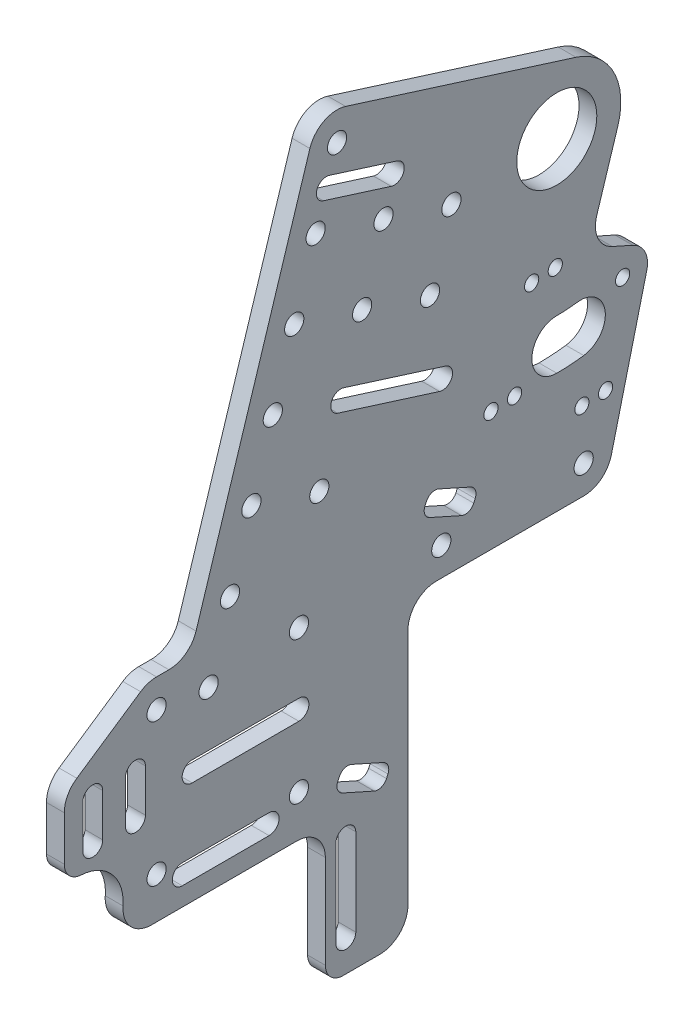
from build123d import *

# Parameters (mm, degrees)
BOSS_EXTRUDE1_DEPTH      = 3.175
BOSS_EXTRUDE1_DEPTH_BACK = 3.175
SKETCH2_R                = 14.2875
SKETCH2_R_2              = 3.429
SKETCH2_R_3              = 2.54


with BuildPart() as part:
    # Sketch2 → Boss-Extrude1 (new, two sides: drawn at the far end of the back side and taken through both)
    with BuildSketch(Plane(origin=(0, 0, 0), x_dir=(0, 0, -1), z_dir=(1, 0, 0)).offset(-BOSS_EXTRUDE1_DEPTH_BACK)):
        with BuildLine():
            Line((38.021448917, 246.234864084), (120.241230069, 220.311066665))
            ThreePointArc((120.241230069, 220.311066665), (133.644163138, 209.06467047), (135.169064986, 191.634962595))
            Line((135.169064986, 191.634962595), (127.622152065, 167.6992128))
            ThreePointArc((127.622152065, 167.6992128), (128.044603019, 160.47960856), (133.162508812, 155.36999111))
            Line((133.162508812, 155.36999111), (140.48887895, 152.092017357))
            ThreePointArc((140.48887895, 152.092017357), (144.852236282, 147.866521475), (145.483799346, 141.825426314))
            Line((145.483799346, 141.825426314), (132.821367632, 91.06703794))
            ThreePointArc((132.821367632, 91.06703794), (129.218084699, 85.519642021), (122.963479706, 83.366234079))
            Line((122.963479706, 83.366234079), (70.42350039, 83.366234079))
            ThreePointArc((70.42350039, 83.366234079), (63.239295493, 80.390438976), (60.26350039, 73.206234079))
            Line((60.26350039, 73.206234079), (60.26350039, -11.7475))
            ThreePointArc((60.26350039, -11.7475), (57.287705287, -18.931704897), (50.10350039, -21.9075))
            Line((50.10350039, -21.9075), (37.1475, -21.9075))
            ThreePointArc((37.1475, -21.9075), (32.657371939, -20.047628061), (30.7975, -15.5575))
            Line((30.7975, -15.5575), (30.7975, 17.78))
            ThreePointArc((30.7975, 17.78), (27.821704897, 24.964204897), (20.6375, 27.94))
            Line((20.6375, 27.94), (-31.256978796, 27.94))
            ThreePointArc((-31.256978796, 27.94), (-38.707276299, 31.19213006), (-41.38801938, 38.866561592))
            ThreePointArc((-41.38801938, 38.866561592), (-45.28789684, 50.537792221), (-56.355984579, 55.915905494))
            ThreePointArc((-56.355984579, 55.915905494), (-60.621662669, 57.889989399), (-62.361270294, 62.25654206))
            Line((-62.361270294, 62.25654206), (-62.361270294, 78.164314079))
            ThreePointArc((-62.361270294, 78.164314079), (-61.17251471, 82.933210558), (-57.884425091, 86.586151856))
            Line((-57.884425091, 86.586151856), (-35.119675091, 101.948071856))
            ThreePointArc((-35.119675091, 101.948071856), (-32.408029017, 103.24198088), (-29.436520294, 103.686234079))
            Line((-29.436520294, 103.686234079), (-25.026637608, 103.686234079))
            ThreePointArc((-25.026637608, 103.686234079), (-19.01893158, 105.6527569), (-15.336873388, 110.791063156))
            Line((-15.336873388, 110.791063156), (25.276513775, 239.600270788))
            ThreePointArc((25.276513775, 239.600270788), (30.274912084, 245.55712993), (38.021448917, 246.234864084))
        make_face()
        with Locations((113.367095492, 198.509097171)):
            Circle(SKETCH2_R, mode=Mode.SUBTRACT)
        with Locations((-29.436520294, 42.726234079)):
            Circle(SKETCH2_R_2, mode=Mode.SUBTRACT)
        with Locations((21.363479706, 93.526234079)):
            Circle(SKETCH2_R_2, mode=Mode.SUBTRACT)
        with Locations((122.963479706, 93.526234079)):
            Circle(SKETCH2_R_2, mode=Mode.SUBTRACT)
        with Locations((104.398969727, 158.50014909)):
            Circle(SKETCH2_R_3, mode=Mode.SUBTRACT)
        with Locations((136.858147411, 143.977222936)):
            Circle(SKETCH2_R_3, mode=Mode.SUBTRACT)
        with Locations((122.335221257, 111.518045252)):
            Circle(SKETCH2_R_3, mode=Mode.SUBTRACT)
        with Locations((89.876043573, 126.040971407)):
            Circle(SKETCH2_R_3, mode=Mode.SUBTRACT)
        with Locations((112.840572264, 159.063757816)):
            Circle(SKETCH2_R_3, mode=Mode.SUBTRACT)
        with Locations((130.776823793, 112.081653978)):
            Circle(SKETCH2_R_3, mode=Mode.SUBTRACT)
        with Locations((98.317646109, 126.604580132)):
            Circle(SKETCH2_R_3, mode=Mode.SUBTRACT)
        with Locations((-29.436520294, 93.526234079)):
            Circle(SKETCH2_R_2, mode=Mode.SUBTRACT)
        with Locations((21.363479706, 42.726234079)):
            Circle(SKETCH2_R_2, mode=Mode.SUBTRACT)
        with Locations((72.163479706, 93.526234079)):
            Circle(SKETCH2_R_2, mode=Mode.SUBTRACT)
        with Locations((34.966277994, 236.545099865)):
            Circle(SKETCH2_R_2, mode=Mode.SUBTRACT)
        with Locations((27.328350687, 212.320689316)):
            Circle(SKETCH2_R_2, mode=Mode.SUBTRACT)
        with Locations((19.690423379, 188.096278767)):
            Circle(SKETCH2_R_2, mode=Mode.SUBTRACT)
        with Locations((12.052496072, 163.871868218)):
            Circle(SKETCH2_R_2, mode=Mode.SUBTRACT)
        with Locations((4.414568765, 139.647457669)):
            Circle(SKETCH2_R_2, mode=Mode.SUBTRACT)
        with Locations((-3.223358543, 115.42304712)):
            Circle(SKETCH2_R_2, mode=Mode.SUBTRACT)
        with Locations((-10.86128585, 91.198636571)):
            Circle(SKETCH2_R_2, mode=Mode.SUBTRACT)
        with Locations((51.552761236, 204.682762008)):
            Circle(SKETCH2_R_2, mode=Mode.SUBTRACT)
        with Locations((43.914833928, 180.458351459)):
            Circle(SKETCH2_R_2, mode=Mode.SUBTRACT)
        with Locations((75.777171785, 197.044834701)):
            Circle(SKETCH2_R_2, mode=Mode.SUBTRACT)
        with Locations((68.139244477, 172.820424152)):
            Circle(SKETCH2_R_2, mode=Mode.SUBTRACT)
        with Locations((28.638979314, 132.009530361)):
            Circle(SKETCH2_R_2, mode=Mode.SUBTRACT)
        with BuildLine():
            Line((30.078004517, 221.041477113), (54.302415066, 213.403549806))
            ThreePointArc((54.302415066, 213.403549806), (58.763142366, 215.72565746), (56.441034713, 220.18638476))
            Line((56.441034713, 220.18638476), (32.216624164, 227.824312067))
            ThreePointArc((32.216624164, 227.824312067), (27.755896864, 225.502204413), (30.078004517, 221.041477113))
        make_face(mode=Mode.SUBTRACT)
        with BuildLine():
            Line((40.124519455, 41.8507866), (51.458122437, 36.779891681))
            ThreePointArc((51.458122437, 36.779891681), (53.202214238, 34.935259556), (53.131121493, 32.397648532))
            Line((53.131121493, 32.397648532), (52.612445559, 31.238392186))
            ThreePointArc((52.612445559, 31.238392186), (50.767813434, 29.494300384), (48.23020241, 29.565393129))
            Line((48.23020241, 29.565393129), (36.896599428, 34.636288048))
            ThreePointArc((36.896599428, 34.636288048), (35.152507627, 36.480920173), (35.223600372, 39.018531197))
            Line((35.223600372, 39.018531197), (35.742276306, 40.177787543))
            ThreePointArc((35.742276306, 40.177787543), (37.586908431, 41.921879344), (40.124519455, 41.8507866))
        make_face(mode=Mode.SUBTRACT)
        with BuildLine():
            Line((66.862832351, 109.733168294), (66.344156417, 108.573911948))
            ThreePointArc((66.344156417, 108.573911948), (66.273063672, 106.036300924), (68.017155474, 104.191668799))
            Line((68.017155474, 104.191668799), (79.350758455, 99.12077388))
            ThreePointArc((79.350758455, 99.12077388), (81.88836948, 99.049681135), (83.733001605, 100.793772937))
            Line((83.733001605, 100.793772937), (84.251677539, 101.953029283))
            ThreePointArc((84.251677539, 101.953029283), (84.322770284, 104.490640307), (82.578678482, 106.335272432))
            Line((82.578678482, 106.335272432), (71.245075501, 111.406167351))
            ThreePointArc((71.245075501, 111.406167351), (68.707464477, 111.477260095), (66.862832351, 109.733168294))
        make_face(mode=Mode.SUBTRACT)
        with BuildLine():
            Line((41.656, 20.2565), (41.656, -10.7315))
            ThreePointArc((41.656, -10.7315), (38.1, -14.2875), (34.544, -10.7315))
            Line((34.544, -10.7315), (34.544, 20.2565))
            ThreePointArc((34.544, 20.2565), (38.1, 23.8125), (41.656, 20.2565))
        make_face(mode=Mode.SUBTRACT)
        with BuildLine():
            Line((-20.2565, 41.656), (10.7315, 41.656))
            ThreePointArc((10.7315, 41.656), (14.2875, 38.1), (10.7315, 34.544))
            Line((10.7315, 34.544), (-20.2565, 34.544))
            ThreePointArc((-20.2565, 34.544), (-23.8125, 38.1), (-20.2565, 41.656))
        make_face(mode=Mode.SUBTRACT)
        with BuildLine():
            Line((-48.645270294, 78.164314079), (-48.645270294, 62.924314079))
            ThreePointArc((-48.645270294, 62.924314079), (-52.201270294, 59.368314079), (-55.757270294, 62.924314079))
            Line((-55.757270294, 62.924314079), (-55.757270294, 78.164314079))
            ThreePointArc((-55.757270294, 78.164314079), (-52.201270294, 81.720314079), (-48.645270294, 78.164314079))
        make_face(mode=Mode.SUBTRACT)
        with BuildLine():
            Line((-33.405270294, 78.164314079), (-33.405270294, 62.924314079))
            ThreePointArc((-33.405270294, 62.924314079), (-36.961270294, 59.368314079), (-40.517270294, 62.924314079))
            Line((-40.517270294, 62.924314079), (-40.517270294, 78.164314079))
            ThreePointArc((-40.517270294, 78.164314079), (-36.961270294, 81.720314079), (-33.405270294, 78.164314079))
        make_face(mode=Mode.SUBTRACT)
        with BuildLine():
            Line((37.346216444, 159.625358387), (73.682832268, 148.168467426))
            ThreePointArc((73.682832268, 148.168467426), (76.004939921, 143.707740126), (71.544212621, 141.385632472))
            Line((71.544212621, 141.385632472), (35.207596798, 152.842523433))
            ThreePointArc((35.207596798, 152.842523433), (32.885489144, 157.303250733), (37.346216444, 159.625358387))
        make_face(mode=Mode.SUBTRACT)
        with BuildLine():
            Line((-16.736520294, 71.682234079), (21.363479706, 71.682234079))
            ThreePointArc((21.363479706, 71.682234079), (24.919479706, 68.126234079), (21.363479706, 64.570234079))
            Line((21.363479706, 64.570234079), (-16.736520294, 64.570234079))
            ThreePointArc((-16.736520294, 64.570234079), (-20.292520294, 68.126234079), (-16.736520294, 71.682234079))
        make_face(mode=Mode.SUBTRACT)
        with BuildLine():
            ThreePointArc((113.367095492, 126.119097171), (118.189521471, 126.279904266), (122.990522384, 126.761611119))
            ThreePointArc((122.990522384, 126.761611119), (130.619792807, 136.754530252), (120.626873673, 144.383800675))
            ThreePointArc((120.626873673, 144.383800675), (117.005065968, 144.020407787), (113.367095492, 143.899097171))
            ThreePointArc((113.367095492, 143.899097171), (104.477095492, 135.009097171), (113.367095492, 126.119097171))
        make_face(mode=Mode.SUBTRACT)
    extrude(amount=BOSS_EXTRUDE1_DEPTH + BOSS_EXTRUDE1_DEPTH_BACK)


solid = part.part
